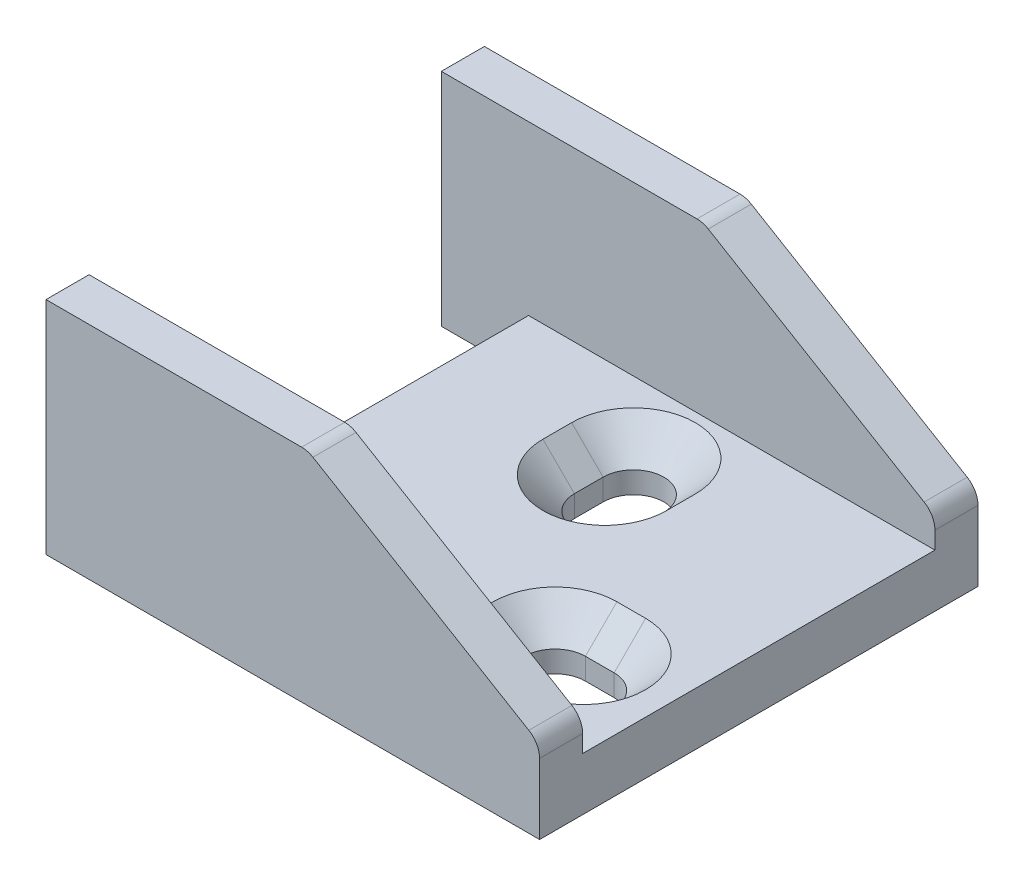
from build123d import *

# Parameters (mm, degrees)
SKETCH1_W           = 36.8
SKETCH1_H           = 39.7
BOSS_EXTRUDE1_DEPTH = 4.8
SKETCH2_W           = 44.7
SKETCH2_H           = 3.9
BOSS_EXTRUDE2_DEPTH = 20
CUT_EXTRUDE1_REACH  = 58.226
CHAMFER1_SIZE       = 2.85
CUT_EXTRUDE2_DEPTH  = 58.709011428
FILLET1_R           = 2


with BuildPart() as part:
    # Sketch1 → Boss-Extrude1 (new body)
    with BuildSketch(Plane(origin=(0, 0, 0), x_dir=(1, 0, 0), z_dir=(0, 1, 0))):
        with Locations((18.4, 19.85)):
            Rectangle(SKETCH1_W, SKETCH1_H)
    extrude(amount=BOSS_EXTRUDE1_DEPTH)

    # Sketch2 → Boss-Extrude2 (add)
    with BuildSketch(Plane(origin=(0, 0, 0), x_dir=(1, 0, 0), z_dir=(0, 1, 0))):
        with Locations((14.45, 37.75)):
            Rectangle(SKETCH2_W, SKETCH2_H)
        with Locations((14.45, 1.95)):
            Rectangle(SKETCH2_W, SKETCH2_H)
    extrude(amount=BOSS_EXTRUDE2_DEPTH)

    # Sketch3 → Cut-Extrude1 (cut, up to next)
    with BuildSketch(Plane(origin=(0, 4.8, 0), x_dir=(1, 0, 0), z_dir=(0, 1, 0)), mode=Mode.PRIVATE) as cut_extrude1_sk1:
        with BuildLine():
            Line((26.45, 14.5), (29.05, 14.5))
            ThreePointArc((29.05, 14.5), (31.8, 11.75), (29.05, 9))
            Line((29.05, 9), (26.45, 9))
            ThreePointArc((26.45, 9), (23.7, 11.75), (26.45, 14.5))
        make_face()
    cut_extrude1_tool1 = extrude(cut_extrude1_sk1.sketch, amount=-CUT_EXTRUDE1_REACH, mode=Mode.PRIVATE) & part.part
    # Sketch3 → Cut-Extrude1 (cut, up to next)
    with BuildSketch(Plane(origin=(0, 4.8, 0), x_dir=(1, 0, 0), z_dir=(0, 1, 0)), mode=Mode.PRIVATE) as cut_extrude1_sk2:
        with BuildLine():
            Line((18.7, 29.35), (18.7, 26.75))
            ThreePointArc((18.7, 26.75), (15.95, 24), (13.2, 26.75))
            Line((13.2, 26.75), (13.2, 29.35))
            ThreePointArc((13.2, 29.35), (15.95, 32.1), (18.7, 29.35))
        make_face()
    cut_extrude1_tool2 = extrude(cut_extrude1_sk2.sketch, amount=-CUT_EXTRUDE1_REACH, mode=Mode.PRIVATE) & part.part
    add(cut_extrude1_tool1.solids().sort_by_distance((27.75, 4.8, -11.75))[0], mode=Mode.SUBTRACT)
    add(cut_extrude1_tool2.solids().sort_by_distance((15.95, 4.8, -28.05))[0], mode=Mode.SUBTRACT)

    # Chamfer1
    chamfer1_edges = [part.edges().sort_by_distance(p)[0] for p in [
        (23.7, 4.8, -11.75),
        (27.75, 4.8, -9),
        (31.8, 4.8, -11.75),
        (27.75, 4.8, -14.5),
        (13.2, 4.8, -28.05),
        (15.95, 4.8, -24),
        (18.7, 4.8, -28.05),
        (15.95, 4.8, -32.1),
    ]]
    chamfer(chamfer1_edges, length=CHAMFER1_SIZE)

    # Sketch4 → Cut-Extrude2 (cut, through all)
    with BuildSketch(Plane(origin=(0, 0, -39.7), x_dir=(-1, 0, 0), z_dir=(0, 0, -1))):
        Polygon((-36.8, 20), (-36.8, 7.5), (-15.8, 20), align=None)
    extrude(amount=-CUT_EXTRUDE2_DEPTH, mode=Mode.SUBTRACT)

    # Fillet1
    fillet1_edges = [part.edges().sort_by_distance(p)[0] for p in [
        (36.8, 7.5, -1.95),
        (36.8, 7.5, -37.75),
        (15.8, 20, -37.75),
        (15.8, 20, -1.95),
    ]]
    fillet(fillet1_edges, radius=FILLET1_R)


solid = part.part
